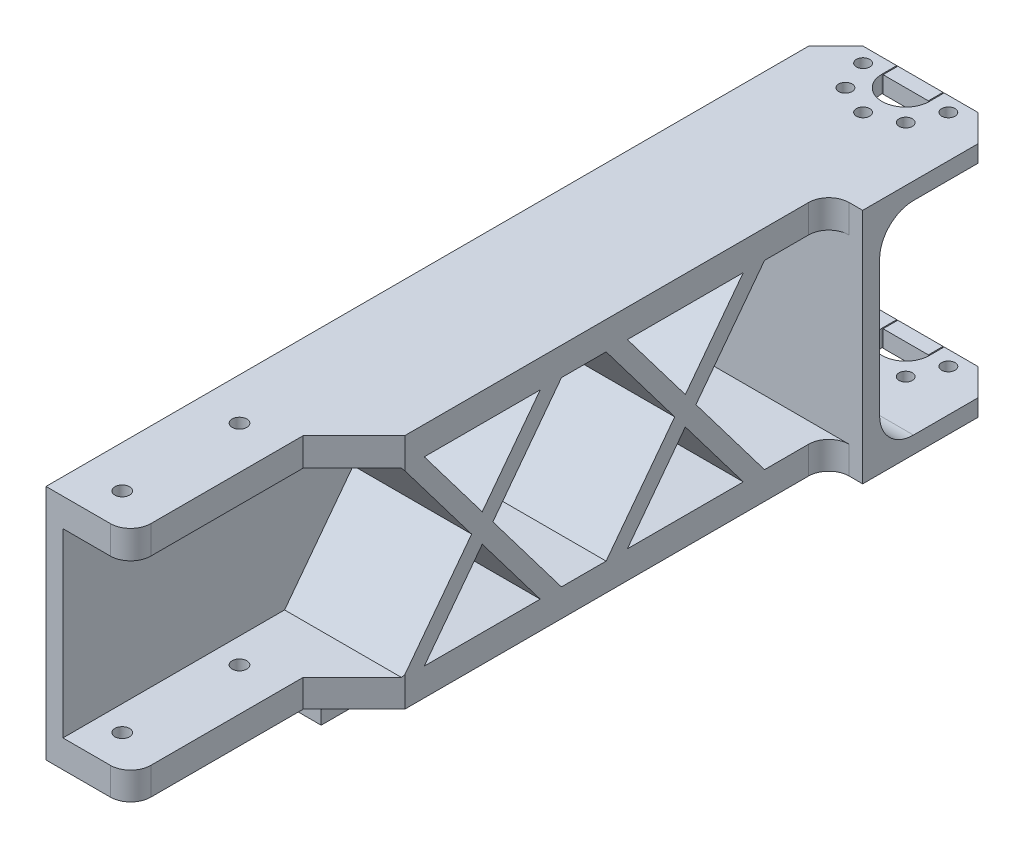
from build123d import *

# Parameters (mm, degrees)
BOSS_EXTRUDE1_DEPTH     = 15.875
CUT_EXTRUDE1_DEPTH      = 122.108682072
CUT_EXTRUDE1_DEPTH_BACK = 122.108682072
SKETCH2_R               = 1.25
SKETCH2_R_2             = 1.239025097
CUT_EXTRUDE2_DEPTH      = 122.108682072
CUT_EXTRUDE2_DEPTH_BACK = 122.108682072
SKETCH4_R               = 4.445
SKETCH5_W               = 121.475
SKETCH5_H               = 44.451600064
BOSS_EXTRUDE2_DEPTH     = 3.175
SKETCH6_W               = 22.225
SKETCH6_H               = 5.276600064
SKETCH6_H_2             = 5.175
BOSS_EXTRUDE3_DEPTH     = 121.475
SKETCH7_R               = 1.375
CUT_EXTRUDE3_DEPTH      = 236.128722189
SKETCH8_W               = 9.525
SKETCH8_H               = 31.75
CUT_EXTRUDE4_DEPTH      = 236.128722189
FILLET3_R               = 3.81
BOSS_EXTRUDE4_DEPTH     = 22.225
LPATTERN1_COUNT         = 2
LPATTERN1_PITCH         = 38.1
FILLET5_R               = 6.35
BOSS_EXTRUDE5_DEPTH     = 82.55
FILLET6_R               = 1.27
BOSS_EXTRUDE6_DEPTH     = 82.55
CUT_EXTRUDE5_DEPTH      = 236.128722189
SKETCH15_W              = 8.49
SKETCH15_H              = 2.765
BOSS_EXTRUDE7_DEPTH     = 3.175
SKETCH17_W              = 8.49
SKETCH17_H              = 2.765
BOSS_EXTRUDE8_DEPTH     = 3.175
CHAMFER1_SIZE           = 10.16
FILLET7_R               = 3.81
CHAMFER2_SIZE           = 5.08
BOSS_EXTRUDE9_DEPTH     = 0.762


with BuildPart() as part:
    # Sketch1 → Boss-Extrude1 (new, symmetric)
    with BuildSketch(Plane.ZY.offset(21)):
        Polygon((70.722864926, 19.101600064), (103.275, 19.101600064), (103.275, -19), (69.575, -19), (69.575, -22.175), (106.45, -22.175), (106.45, 22.276600064), (70.722864926, 22.276600064), align=None)
    extrude(amount=BOSS_EXTRUDE1_DEPTH, both=True)

    # Sketch2 → Cut-Extrude1 (cut, two sides: drawn at the far end of the back side and taken through both)
    with BuildSketch(Plane(origin=(0, -22.175, 0), x_dir=(1, 0, 0), z_dir=(0, 1, 0)).offset(-CUT_EXTRUDE1_DEPTH_BACK)):
        with Locations(Location((-15.343145751, -88.156854249, 0), (0, 0, 270))):
            Circle(SKETCH2_R)
        with Locations(Location((-21, -90.5, 0), (0, 0, 270))):
            Circle(SKETCH2_R)
        with Locations(Location((-26.656854249, -88.156854249, 0), (0, 0, 270))):
            Circle(SKETCH2_R)
        with Locations(Location((-29, -82.5, 0), (0, 0, 270))):
            Circle(SKETCH2_R)
        with Locations(Location((-26.656854249, -76.843145751, 0), (0, 0, 270))):
            Circle(SKETCH2_R)
        with Locations(Location((-21, -74.5, 0), (0, 0, 270))):
            Circle(SKETCH2_R_2)
        with Locations(Location((-15.343145751, -76.843145751, 0), (0, 0, 270))):
            Circle(SKETCH2_R)
        with Locations(Location((-13, -82.5, 0), (0, 0, 270))):
            Circle(SKETCH2_R)
    extrude(amount=CUT_EXTRUDE1_DEPTH + CUT_EXTRUDE1_DEPTH_BACK, mode=Mode.SUBTRACT)

    # Sketch4 → Cut-Extrude2 (cut, two sides: drawn at the far end of the back side and taken through both)
    with BuildSketch(Plane(origin=(0, 22.276600064, 0), x_dir=(1, 0, 0), z_dir=(0, 1, 0)).offset(-CUT_EXTRUDE2_DEPTH_BACK)):
        with Locations(Location((-21, -82.5, 0), (0, 0, 270))):
            Circle(SKETCH4_R)
    extrude(amount=CUT_EXTRUDE2_DEPTH + CUT_EXTRUDE2_DEPTH_BACK, mode=Mode.SUBTRACT)

    # Sketch5 → Boss-Extrude2 (add)
    with BuildSketch(Plane.ZY.offset(36.875)):
        with Locations((167.1875, 0.050800032)):
            Rectangle(SKETCH5_W, SKETCH5_H)
    extrude(amount=-BOSS_EXTRUDE2_DEPTH)

    # Sketch6 → Boss-Extrude3 (add)
    with BuildSketch(Plane.XY.offset(227.925)):
        with Locations((-22.5875, 19.638300032)):
            Rectangle(SKETCH6_W, SKETCH6_H)
        with Locations((-22.5875, -19.5875)):
            Rectangle(SKETCH6_W, SKETCH6_H_2)
    extrude(amount=-BOSS_EXTRUDE3_DEPTH)

    # Sketch7 → Cut-Extrude3 (cut, through all)
    with BuildSketch(Plane(origin=(0, 22.276600064, 0), x_dir=(1, 0, 0), z_dir=(0, 1, 0))):
        with Locations(Location((-29, -221.5, 0), (0, 0, 270))):
            Circle(SKETCH7_R)
        with Locations(Location((-29, -199.5, 0), (0, 0, 270))):
            Circle(SKETCH7_R)
    extrude(amount=-CUT_EXTRUDE3_DEPTH, mode=Mode.SUBTRACT)

    # Sketch8 → Cut-Extrude4 (cut, through all)
    with BuildSketch(Plane.XZ.offset(22.175)):
        with Locations((-16.2375, 212.05)):
            Rectangle(SKETCH8_W, SKETCH8_H)
    extrude(amount=-CUT_EXTRUDE4_DEPTH, mode=Mode.SUBTRACT)

    # Fillet3
    fillet3_edges = [part.edges().sort_by_distance(p)[0] for p in [
        (-21, 19.638300032, 227.925),
        (-21, -19.5875, 227.925),
    ]]
    fillet(fillet3_edges, radius=FILLET3_R)

    # Sketch9 → Boss-Extrude4 (add)
    with BuildSketch(Plane(origin=(-11.475, 0, 0), x_dir=(0, 0, -1), z_dir=(1, 0, 0))):
        Polygon((-148.234856752, -17), (-135.367396314, 0), (-148.234856752, 17), (-144.252905599, 17), (-133.376420737, 2.630401311), (-122.499935875, 17), (-118.517984721, 17), (-131.38544516, 0), (-118.517984721, -17), (-122.499935875, -17), (-133.376420737, -2.630401311), (-144.252905599, -17), align=None)
    boss_extrude4 = extrude(amount=-BOSS_EXTRUDE4_DEPTH)

    # LPattern1: Boss-Extrude4 ×2
    with Locations(*[(0, 0, i * LPATTERN1_PITCH) for i in range(1, LPATTERN1_COUNT)]):
        add(boss_extrude4)

    # Fillet5
    fillet5_edges = [part.edges().sort_by_distance(p)[0] for p in [
        (-21, -19, 103.275),
        (-21, 19.101600064, 103.275),
    ]]
    fillet(fillet5_edges, radius=FILLET5_R)

    # Sketch11 → Boss-Extrude5 (add)
    with BuildSketch(Plane.XY.offset(106.45)):
        Polygon((-34.335, -27.098049631), (-34.335, -22.175), (-36.875, -22.175), (-36.875, -29.638049631), (-24.175, -29.638049631), (-24.175, -27.098049631), align=None)
    extrude(amount=BOSS_EXTRUDE5_DEPTH)

    # Fillet6
    fillet6_edges = [part.edges().sort_by_distance(p)[0] for p in [
        (-34.335, -27.098049631, 147.725),
        (-34.335, -22.175, 147.725),
    ]]
    fillet(fillet6_edges, radius=FILLET6_R)

    # Sketch12 → Boss-Extrude6 (add)
    with BuildSketch(Plane.XY.offset(189)):
        Polygon((-24.175, -27.098049631), (-26.569978366, -24.703071266), (-28.964956731, -27.098049631), align=None)
    extrude(amount=-BOSS_EXTRUDE6_DEPTH)

    # Sketch14 → Cut-Extrude5 (cut, through all)
    with BuildSketch(Plane.XZ.offset(22.175)):
        with BuildLine():
            Line((-5.125, 69.575), (-36.875, 69.575))
            Line((-36.875, 69.575), (-36.875, 79.735))
            Line((-36.875, 79.735), (-25.445, 79.735))
            Line((-25.445, 79.735), (-25.445, 82.5))
            ThreePointArc((-25.445, 82.5), (-25.196913013, 81.035777968), (-24.480344811, 79.735))
            Line((-24.480344811, 79.735), (-17.519655189, 79.735))
            ThreePointArc((-17.519655189, 79.735), (-16.803086987, 81.035777968), (-16.555, 82.5))
            Line((-16.555, 82.5), (-16.555, 79.735))
            Line((-16.555, 79.735), (-5.125, 79.735))
            Line((-5.125, 79.735), (-5.125, 69.575))
        make_face()
    extrude(amount=-CUT_EXTRUDE5_DEPTH, mode=Mode.SUBTRACT)

    # Chamfer1
    # the kernel refuses this chamfer: 10.16 mm, written as the material it takes off along each edge
    with BuildSketch(Plane(origin=(-11.475, -9.128299158, 196.175), x_dir=(-0.9996219169112966, 0, 0.02749587661058728), z_dir=(0, 1, 0))) as chamfer1_piece_1_section:
        Polygon((CHAMFER1_SIZE * 0.999621916911, -CHAMFER1_SIZE * 0.0274958766106), (-CHAMFER1_SIZE * 0.0274958766106, -CHAMFER1_SIZE * 0.999621916911), (0, 0), align=None)
    chamfer1_piece_1 = extrude(amount=57.533198379, mode=Mode.PRIVATE)
    chamfer1_piece_1 = split(chamfer1_piece_1, bisect_by=Plane(origin=(-21, 19.638300032, 192.788920265), z_dir=(1, 0, 0)), keep=Keep.TOP, mode=Mode.PRIVATE)
    add(chamfer1_piece_1, mode=Mode.SUBTRACT)
    with BuildSketch(Plane(origin=(-11.475, -48.303299158, 196.175), x_dir=(-0.9996219169112966, 0, 0.02749587661058728), z_dir=(0, 1, 0))) as chamfer1_piece_2_section:
        Polygon((CHAMFER1_SIZE * 0.999621916911, -CHAMFER1_SIZE * 0.0274958766106), (-CHAMFER1_SIZE * 0.0274958766106, -CHAMFER1_SIZE * 0.999621916911), (0, 0), align=None)
    chamfer1_piece_2 = extrude(amount=57.431598315, mode=Mode.PRIVATE)
    chamfer1_piece_2 = split(chamfer1_piece_2, bisect_by=Plane(origin=(-21, -19.5875, 192.788920265), z_dir=(1, 0, 0)), keep=Keep.TOP, mode=Mode.PRIVATE)
    add(chamfer1_piece_2, mode=Mode.SUBTRACT)

    # Fillet7
    fillet7_edges = [part.edges().sort_by_distance(p)[0] for p in [
        (-11.475, 19.638300032, 106.45),
        (-11.475, -19.5875, 106.45),
    ]]
    fillet(fillet7_edges, radius=FILLET7_R)

    # Chamfer2
    chamfer2_edges = [part.edges().sort_by_distance(p)[0] for p in [
        (-5.125, -20.5875, 79.735),
        (-36.875, -20.5875, 79.735),
        (-5.125, 20.689100064, 79.735),
        (-36.875, 20.689100064, 79.735),
    ]]
    chamfer(chamfer2_edges, length=CHAMFER2_SIZE)

    # Sketch18 → Boss-Extrude9 (add)
    # profile 1 of 6: a face of its own
    with BuildSketch(Plane(origin=(-33.7, 0, 0), x_dir=(0, 0, -1), z_dir=(1, 0, 0))):
        with BuildLine():
            Line((-153.784229193, 6.875972625), (-153.784229193, 5.570495519))
            add(Edge.make_bspline(
                [(-153.784229193, 5.570495519), (-153.78447547, 5.483681049), (-153.784960426, 5.312731111), (-153.781434088, 5.060104334), (-153.775429266, 4.815104108), (-153.768703986, 4.577142121), (-153.757537017, 4.346091548), (-153.74529407, 4.122111186), (-153.731996283, 3.905132454), (-153.719776818, 3.763234825), (-153.713757159, 3.693331981)],
                knots=[0, 0, 0, 0, 1.108788663, 2.183361313, 3.226731966, 4.238906683, 5.223730476, 6.181032146, 7.103924245, 8, 8, 8, 8], degree=3))
            Line((-153.713757159, 3.693331981), (-153.724504892, 3.694050577))
            add(Edge.make_bspline(
                [(-153.724504892, 3.694050577), (-153.771784627, 3.811311397), (-153.868859565, 4.05207177), (-154.030553624, 4.41072253), (-154.201420622, 4.767436486), (-154.324537463, 4.999071707), (-154.384865125, 5.112573737)],
                knots=[0, 0, 0, 0, 0.969000566, 1.989555744, 3.014875613, 4, 4, 4, 4], degree=3))
            Line((-154.384865125, 5.112573737), (-155.318936063, 6.875167605))
            Line((-155.318936063, 6.875167605), (-156.196611608, 6.875167605))
            Line((-156.196611608, 6.875167605), (-156.196611608, 2.51959323))
            Line((-156.196611608, 2.51959323), (-155.46896261, 2.51959323))
            Line((-155.46896261, 2.51959323), (-155.46896261, 3.856284456))
            add(Edge.make_bspline(
                [(-155.46896261, 3.856284456), (-155.46908302, 3.950283681), (-155.469318899, 4.134423845), (-155.472236083, 4.403774194), (-155.474742855, 4.660281321), (-155.481228605, 4.903901107), (-155.486998086, 5.13666602), (-155.496698186, 5.359510985), (-155.505980252, 5.573425166), (-155.514136603, 5.712946629), (-155.518128029, 5.781223433)],
                knots=[0, 0, 0, 0, 1.171406079, 2.294730703, 3.356826466, 4.368057606, 5.33173858, 6.258348936, 7.147698386, 8, 8, 8, 8], degree=3))
            Line((-155.518128029, 5.781223433), (-155.49611402, 5.782026052))
            add(Edge.make_bspline(
                [(-155.49611402, 5.782026052), (-155.446972057, 5.659565606), (-155.346739531, 5.40978886), (-155.178935485, 5.039911421), (-155.001921255, 4.674979243), (-154.878142422, 4.436827616), (-154.817520811, 4.320191071)],
                knots=[0, 0, 0, 0, 0.98187706, 2.002687931, 3.021801436, 4, 4, 4, 4], degree=3))
            Line((-154.817520811, 4.320191071), (-153.865003238, 2.51959323))
            Line((-153.865003238, 2.51959323), (-153.056580194, 2.51959323))
            Line((-153.056580194, 2.51959323), (-153.056580194, 6.875167605))
            Line((-153.056580194, 6.875167605), (-153.784229193, 6.875972625))
        make_face()
    # profile 2 of 6: a face of its own
    with BuildSketch(Plane(origin=(-33.7, 0, 0), x_dir=(0, 0, -1), z_dir=(1, 0, 0))):
        with BuildLine():
            Line((-152.158491877, 2.545664346), (-151.325956652, 2.545664346))
            Line((-151.325956652, 2.545664346), (-151.325956652, 4.312815458))
            Line((-151.325956652, 4.312815458), (-151.043397933, 4.312815458))
            add(Edge.make_bspline(
                [(-151.043397933, 4.312815458), (-151.020116935, 4.312629528), (-150.974322245, 4.312263796), (-150.907690471, 4.305622213), (-150.844710057, 4.294546892), (-150.786397272, 4.276982957), (-150.731822853, 4.255385538), (-150.682321062, 4.226634819), (-150.635981149, 4.194321952), (-150.594394025, 4.154838787), (-150.556530015, 4.108797286), (-150.519980337, 4.056375759), (-150.487794472, 3.994799049), (-150.456381733, 3.926409266), (-150.429254847, 3.849561841), (-150.402405374, 3.765959509), (-150.380064022, 3.673755628), (-150.366763652, 3.609516607), (-150.359856172, 3.5761544)],
                knots=[0, 0, 0, 0, 0.996161344, 1.959490833, 2.863065066, 3.728777099, 4.56255315, 5.36890551, 6.173560641, 6.975918819, 7.814273396, 8.722375339, 9.705928526, 10.783915222, 11.941699738, 13.191639415, 14.541492272, 16, 16, 16, 16], degree=3))
            add(Edge.make_bspline(
                [(-150.359856172, 3.5761544), (-150.347172865, 3.51248186), (-150.322861848, 3.390436072), (-150.285466531, 3.215466651), (-150.247477803, 3.05722524), (-150.212465806, 2.915625934), (-150.1766324, 2.793695477), (-150.146487515, 2.691321829), (-150.118423004, 2.610432738), (-150.098154609, 2.564887706), (-150.089446369, 2.545319452)],
                knots=[0, 0, 0, 0, 1.459770129, 2.798047569, 4.022515533, 5.118804131, 6.077119604, 6.879484601, 7.518574734, 8, 8, 8, 8], degree=3))
            Line((-150.089446369, 2.545319452), (-149.232635718, 2.545664346))
            add(Edge.make_bspline(
                [(-149.232635718, 2.545664346), (-149.244144057, 2.571885506), (-149.27048373, 2.631899101), (-149.303988323, 2.73729745), (-149.341893864, 2.867004922), (-149.38067392, 3.019220809), (-149.421254764, 3.187766703), (-149.465172423, 3.366494012), (-149.50909941, 3.553465445), (-149.539062356, 3.68076861), (-149.554362728, 3.745775094)],
                knots=[0, 0, 0, 0, 0.552213745, 1.263877434, 2.131178881, 3.160222016, 4.294062084, 5.476483125, 6.711383475, 8, 8, 8, 8], degree=3))
            add(Edge.make_bspline(
                [(-149.554362728, 3.745775094), (-149.567192481, 3.798993869), (-149.591990861, 3.901859401), (-149.641231319, 4.046808684), (-149.697748442, 4.177557345), (-149.762011225, 4.293912743), (-149.836373712, 4.395786592), (-149.921846252, 4.482135395), (-150.020154042, 4.551498084), (-150.092406961, 4.584593382), (-150.128778704, 4.601253382)],
                knots=[0, 0, 0, 0, 1.223024066, 2.363959412, 3.416475858, 4.403144149, 5.328653403, 6.226529264, 7.107244077, 8, 8, 8, 8], degree=3))
            Line((-150.128778704, 4.601253382), (-150.128132928, 4.618538899))
            add(Edge.make_bspline(
                [(-150.128132928, 4.618538899), (-150.077554527, 4.640470017), (-149.976629392, 4.684231799), (-149.839359849, 4.777599322), (-149.713340614, 4.88833623), (-149.620191881, 4.995979364), (-149.554926608, 5.091584295), (-149.511518513, 5.167711217), (-149.474276544, 5.247664472), (-149.444191144, 5.33173326), (-149.4193357, 5.419537131), (-149.40152435, 5.51163573), (-149.389814986, 5.607490951), (-149.387536116, 5.672752954), (-149.38638088, 5.705836458)],
                knots=[0, 0, 0, 0, 1.415552172, 2.824620626, 4.248504358, 5.723320941, 6.471745732, 7.223921719, 7.975309537, 8.737754725, 9.518628704, 10.320683298, 11.148697904, 12, 12, 12, 12], degree=3))
            add(Edge.make_bspline(
                [(-149.38638088, 5.705836458), (-149.388703662, 5.739746794), (-149.393268346, 5.806386692), (-149.406894844, 5.903345987), (-149.423043465, 5.995848679), (-149.443263583, 6.083207064), (-149.468079968, 6.165796508), (-149.496585732, 6.243612788), (-149.529128545, 6.316621571), (-149.566421005, 6.384413386), (-149.60740769, 6.447245042), (-149.651265194, 6.506283303), (-149.701316235, 6.558326519), (-149.753568187, 6.60756697), (-149.811163544, 6.650481415), (-149.872211708, 6.689686295), (-149.937721797, 6.722964168), (-150.029219919, 6.76046179), (-150.14530935, 6.798858265), (-150.2819957, 6.841750058), (-150.416641379, 6.873910739), (-150.54711036, 6.90090002), (-150.674733173, 6.918335329), (-150.798786655, 6.930892024), (-150.919850532, 6.932948616), (-150.999292438, 6.929360641), (-151.038338952, 6.927597115)],
                knots=[0, 0, 0, 0, 1.04254728, 2.048792541, 3.00224853, 3.923105087, 4.79804786, 5.646501919, 6.464227683, 7.248100506, 8.017504481, 8.765055913, 9.500244792, 10.229727568, 10.965537121, 11.700200404, 12.45355415, 13.216173449, 14.732128481, 16.203485081, 17.610025167, 18.977448705, 20.289434687, 21.560307215, 22.800865913, 24, 24, 24, 24], degree=3))
            add(Edge.make_bspline(
                [(-151.038338952, 6.927597115), (-151.142710082, 6.926370079), (-151.346710825, 6.923971752), (-151.59718684, 6.907515826), (-151.787142677, 6.889753053), (-151.918831852, 6.875106189), (-152.042083899, 6.858925349), (-152.12109864, 6.846114274), (-152.159310501, 6.839918785)],
                knots=[0, 0, 0, 0, 1.668967631, 3.262115064, 4.012317135, 4.719957541, 5.380966089, 6, 6, 6, 6], degree=3))
            Line((-152.159310501, 6.839918785), (-152.158491877, 2.545664346))
        make_face()
        with BuildLine():
            add(Edge.make_bspline(
                [(-151.325956652, 6.271426825), (-151.305282152, 6.276726825), (-151.256844897, 6.289143931), (-151.171532053, 6.297826115), (-151.06441091, 6.304689515), (-150.985643666, 6.30478358), (-150.942466385, 6.304835143)],
                knots=[0, 0, 0, 0, 0.662678564, 1.552556538, 2.658402302, 4, 4, 4, 4], degree=3))
            add(Edge.make_bspline(
                [(-150.942466385, 6.304835143), (-150.901672634, 6.305081522), (-150.819974195, 6.305574949), (-150.698384418, 6.281999303), (-150.579140402, 6.241066117), (-150.482577542, 6.193459011), (-150.410224487, 6.143198487), (-150.361957794, 6.09563123), (-150.321085104, 6.039194061), (-150.285869156, 5.974431955), (-150.26006297, 5.900246358), (-150.238072871, 5.818526129), (-150.224600422, 5.727805056), (-150.220864032, 5.66435927), (-150.218915305, 5.631268906)],
                knots=[0, 0, 0, 0, 1.299862039, 2.603258977, 3.929761489, 5.318199205, 6.024796415, 6.733972064, 7.470037642, 8.242600901, 9.078567026, 9.971200204, 10.941872601, 12, 12, 12, 12], degree=3))
            add(Edge.make_bspline(
                [(-150.218915305, 5.631268906), (-150.219841826, 5.605560755), (-150.221652272, 5.555326325), (-150.231696559, 5.482124472), (-150.247127418, 5.412621189), (-150.268977447, 5.347052139), (-150.298242319, 5.285674704), (-150.333196189, 5.228360606), (-150.374976927, 5.175544089), (-150.421400297, 5.12616591), (-150.473986657, 5.082037231), (-150.531443748, 5.04312415), (-150.594758499, 5.011193378), (-150.662479769, 4.984282135), (-150.735409292, 4.962740184), (-150.813060503, 4.94758222), (-150.895775319, 4.9374308), (-150.952541631, 4.935667568), (-150.98179872, 4.934758806)],
                knots=[0, 0, 0, 0, 1.059346065, 2.069991167, 3.039184971, 3.989375718, 4.910601955, 5.835121727, 6.749101981, 7.680445877, 8.622807178, 9.571664136, 10.532985652, 11.538164881, 12.57081342, 13.661090204, 14.794536924, 16, 16, 16, 16], degree=3))
            Line((-150.98179872, 4.934758806), (-151.325956652, 4.935577429))
            Line((-151.325956652, 4.935577429), (-151.325956652, 6.271426825))
        make_face(mode=Mode.SUBTRACT)
    # profile 3 of 6: a face of its own
    with BuildSketch(Plane(origin=(-33.7, 0, 0), x_dir=(0, 0, -1), z_dir=(1, 0, 0))):
        with BuildLine():
            Line((-155.280335928, -4.927307934), (-155.280335928, -4.915914424))
            Line((-155.280335928, -4.915914424), (-154.923507338, -4.562715625))
            add(Edge.make_bspline(
                [(-154.923507338, -4.562715625), (-154.846387042, -4.484813077), (-154.694632231, -4.331518976), (-154.484916138, -4.092136642), (-154.295566432, -3.849527246), (-154.150659641, -3.645397797), (-154.048819061, -3.478739381), (-153.982883809, -3.351689584), (-153.926379814, -3.222517898), (-153.879354937, -3.090872744), (-153.842376036, -2.956942864), (-153.815346476, -2.820556036), (-153.797867991, -2.681685772), (-153.793699009, -2.588173899), (-153.791602405, -2.541146274)],
                knots=[0, 0, 0, 0, 1.659202022, 3.264923779, 4.814209511, 6.316896139, 7.051567576, 7.769144172, 8.482047353, 9.1843673, 9.883576409, 10.583408793, 11.287588645, 12, 12, 12, 12], degree=3))
            add(Edge.make_bspline(
                [(-153.791602405, -2.541146274), (-153.792168252, -2.497125642), (-153.793282256, -2.410460646), (-153.808656173, -2.283297046), (-153.832960787, -2.161183601), (-153.867954163, -2.044645443), (-153.914554102, -1.93409838), (-153.97020222, -1.828861322), (-154.036394593, -1.729010122), (-154.112247898, -1.634822556), (-154.198851853, -1.547981962), (-154.298374012, -1.47343055), (-154.408067128, -1.408781335), (-154.529686139, -1.356589889), (-154.662071459, -1.31496444), (-154.805537914, -1.284160169), (-154.960066308, -1.263237003), (-155.06710206, -1.259195408), (-155.122346407, -1.25710942)],
                knots=[0, 0, 0, 0, 1.009543328, 1.987524111, 2.933968874, 3.863854154, 4.774078899, 5.682489326, 6.591612952, 7.518557726, 8.453666412, 9.397555261, 10.363899254, 11.368743061, 12.427215963, 13.543452787, 14.732102632, 16, 16, 16, 16], degree=3))
            add(Edge.make_bspline(
                [(-155.122346407, -1.25710942), (-155.18332199, -1.259156111), (-155.303204528, -1.263180059), (-155.478967158, -1.285505495), (-155.647019616, -1.321500931), (-155.805765068, -1.370931789), (-155.954429066, -1.428591387), (-156.090186151, -1.493526497), (-156.213927099, -1.562098926), (-156.287249375, -1.616069269), (-156.32280205, -1.642238534)],
                knots=[0, 0, 0, 0, 1.142131743, 2.245516072, 3.313064714, 4.356728811, 5.356075675, 6.296497493, 7.174001758, 8, 8, 8, 8], degree=3))
            Line((-156.32280205, -1.642238534), (-156.090280187, -2.244136411))
            add(Edge.make_bspline(
                [(-156.090280187, -2.244136411), (-156.064471491, -2.225123975), (-156.011266071, -2.185929254), (-155.925601122, -2.131482591), (-155.832370327, -2.079945383), (-155.733817552, -2.030713133), (-155.629485773, -1.988709844), (-155.520591575, -1.957356083), (-155.407681507, -1.937123867), (-155.33083577, -1.9333858), (-155.291967102, -1.931495081)],
                knots=[0, 0, 0, 0, 0.882381775, 1.819057125, 2.791981266, 3.814391476, 4.850565017, 5.88354078, 6.929492323, 8, 8, 8, 8], degree=3))
            add(Edge.make_bspline(
                [(-155.291967102, -1.931495081), (-155.263798128, -1.932680515), (-155.209179783, -1.934979015), (-155.130238271, -1.945771316), (-155.057196883, -1.961841548), (-154.989770986, -1.98406245), (-154.928404776, -2.012601171), (-154.872880006, -2.047068248), (-154.823986916, -2.088028403), (-154.766206637, -2.148918906), (-154.708632812, -2.237393282), (-154.657471141, -2.354337391), (-154.628548432, -2.484035429), (-154.625641074, -2.574054965), (-154.62413683, -2.620630368)],
                knots=[0, 0, 0, 0, 0.93230204, 1.807690748, 2.631964675, 3.403485345, 4.151360469, 4.865902888, 5.558923755, 6.255646087, 7.636553115, 9.02477282, 10.460640741, 12, 12, 12, 12], degree=3))
            add(Edge.make_bspline(
                [(-154.62413683, -2.620630368), (-154.625638781, -2.656473677), (-154.628668576, -2.728778194), (-154.645913211, -2.837297709), (-154.671841732, -2.947200893), (-154.710405875, -3.057791107), (-154.757895641, -3.170085527), (-154.815490097, -3.283540574), (-154.884013893, -3.39773624), (-154.963375025, -3.513383633), (-155.052218259, -3.631915012), (-155.149468362, -3.754975909), (-155.254112856, -3.88381544), (-155.368257383, -4.017224446), (-155.490888432, -4.15573868), (-155.623486892, -4.298025866), (-155.763196658, -4.446473529), (-155.860226208, -4.546144169), (-155.909812532, -4.597080204)],
                knots=[0, 0, 0, 0, 0.714042855, 1.440395043, 2.184640807, 2.96058558, 3.769988571, 4.611854656, 5.492656414, 6.420700846, 7.404361908, 8.442699269, 9.544774642, 10.710251598, 11.939640591, 13.229377797, 14.584091463, 16, 16, 16, 16], degree=3))
            Line((-155.909812532, -4.597080204), (-156.384805372, -5.102968677))
            Line((-156.384805372, -5.102968677), (-156.384805372, -5.602513019))
            Line((-156.384805372, -5.602513019), (-153.711488539, -5.602513019))
            Line((-153.711488539, -5.602513019), (-153.711488539, -4.927307934))
            Line((-153.711488539, -4.927307934), (-155.280335928, -4.927307934))
        make_face()
    # profile 4 of 6: a face of its own
    with BuildSketch(Plane(origin=(-33.7, 0, 0), x_dir=(0, 0, -1), z_dir=(1, 0, 0))):
        with BuildLine():
            add(Edge.make_bspline(
                [(-151.747877407, -5.65003959), (-151.693157485, -5.647769937), (-151.585981546, -5.643324532), (-151.430114225, -5.615054408), (-151.283709293, -5.569208142), (-151.1470325, -5.504528212), (-151.020173233, -5.421913311), (-150.90273255, -5.321783478), (-150.795949505, -5.203505958), (-150.699391291, -5.068171163), (-150.61219055, -4.91728738), (-150.538375401, -4.749780015), (-150.474127746, -4.567999149), (-150.422243879, -4.370867191), (-150.381398801, -4.158692322), (-150.35248186, -3.931529765), (-150.334175085, -3.689183558), (-150.331654824, -3.522576774), (-150.330356921, -3.43677632)],
                knots=[0, 0, 0, 0, 0.891408064, 1.745936256, 2.572046001, 3.384183195, 4.201267044, 5.031441608, 5.891421096, 6.790473701, 7.735400906, 8.72533739, 9.768215703, 10.873507909, 12.042938546, 13.285922414, 14.602283284, 16, 16, 16, 16], degree=3))
            add(Edge.make_bspline(
                [(-150.330356921, -3.43677632), (-150.330632016, -3.36245622), (-150.331171611, -3.216678225), (-150.345851673, -3.002577075), (-150.368655997, -2.797225399), (-150.404337327, -2.601162465), (-150.449134276, -2.414209208), (-150.503777528, -2.235914802), (-150.570703993, -2.067340025), (-150.645425176, -1.907413059), (-150.733149993, -1.761453014), (-150.834386084, -1.632389852), (-150.95043221, -1.523617044), (-151.078626833, -1.431872111), (-151.220912288, -1.360473506), (-151.37595508, -1.308170885), (-151.543531169, -1.272898831), (-151.660104022, -1.265720409), (-151.720099426, -1.262025962)],
                knots=[0, 0, 0, 0, 1.232204757, 2.416955028, 3.556967175, 4.656941594, 5.719331404, 6.743729146, 7.746384706, 8.724983175, 9.668069731, 10.564373225, 11.435956103, 12.296892263, 13.169992217, 14.065276449, 15.004274861, 16, 16, 16, 16], degree=3))
            add(Edge.make_bspline(
                [(-151.720099426, -1.262025962), (-151.778159393, -1.264952258), (-151.891598306, -1.270669723), (-152.055388168, -1.30330911), (-152.207981476, -1.353452288), (-152.34966078, -1.421912395), (-152.479964842, -1.509539078), (-152.598826332, -1.615541492), (-152.706270628, -1.739723163), (-152.800526154, -1.882389981), (-152.884269437, -2.039352558), (-152.957244705, -2.208804572), (-153.018792477, -2.389923703), (-153.068400481, -2.583159474), (-153.107380845, -2.788186575), (-153.136302828, -3.005064066), (-153.152317478, -3.233861139), (-153.154574703, -3.390318402), (-153.155729655, -3.47037269)],
                knots=[0, 0, 0, 0, 0.944846204, 1.846062465, 2.707557854, 3.552303352, 4.397866779, 5.254107521, 6.1362526, 7.061934359, 8.030246202, 9.027537041, 10.060510809, 11.139504921, 12.270844059, 13.454374221, 14.697482908, 16, 16, 16, 16], degree=3))
            add(Edge.make_bspline(
                [(-153.155729655, -3.47037269), (-153.15515763, -3.544966071), (-153.154035427, -3.691303957), (-153.138911922, -3.906023929), (-153.114021091, -4.111869699), (-153.076966732, -4.308242236), (-153.030287518, -4.496048028), (-152.97357082, -4.674963517), (-152.903949364, -4.844025128), (-152.826527301, -5.003645205), (-152.737578412, -5.150301589), (-152.633256596, -5.278311164), (-152.517122457, -5.388929866), (-152.387274195, -5.479409882), (-152.245414143, -5.551906348), (-152.090672175, -5.603701967), (-151.923732707, -5.639207485), (-151.807688654, -5.646358767), (-151.747877407, -5.65003959)],
                knots=[0, 0, 0, 0, 1.232454495, 2.417838968, 3.554913347, 4.657085958, 5.717888946, 6.751365185, 7.755525192, 8.736583815, 9.681064619, 10.58269245, 11.457587613, 12.322870633, 13.188871501, 14.081003943, 15.012277006, 16, 16, 16, 16], degree=3))
        make_face()
        with BuildLine():
            add(Edge.make_bspline(
                [(-151.74224467, -4.984667589), (-151.765579713, -4.983060821), (-151.811384152, -4.979906891), (-151.877509593, -4.960533641), (-151.9382298, -4.92844324), (-151.994857281, -4.885065058), (-152.046376937, -4.829193578), (-152.094085098, -4.762359127), (-152.13654101, -4.683395345), (-152.174893056, -4.593157265), (-152.208006341, -4.490983714), (-152.237484367, -4.377421136), (-152.262447058, -4.252069514), (-152.283836732, -4.115142678), (-152.299792236, -3.966353062), (-152.311850413, -3.805937109), (-152.320352442, -3.633525321), (-152.321686237, -3.514632268), (-152.322375806, -3.453164793)],
                knots=[0, 0, 0, 0, 0.63079115, 1.238182219, 1.84570785, 2.477634685, 3.156537967, 3.891964552, 4.69143895, 5.57447556, 6.538582907, 7.591391793, 8.743788032, 9.991433466, 11.335707708, 12.786810728, 14.338787447, 16, 16, 16, 16], degree=3))
            add(Edge.make_bspline(
                [(-152.322375806, -3.453164793), (-152.321550632, -3.391977503), (-152.319951271, -3.273383624), (-152.313259951, -3.101413343), (-152.299523048, -2.941080131), (-152.283373976, -2.792169025), (-152.260078738, -2.655289051), (-152.233323681, -2.529907128), (-152.201920773, -2.416099935), (-152.164868121, -2.314066034), (-152.124483324, -2.223496516), (-152.079090204, -2.145222099), (-152.03119436, -2.077816744), (-151.978477545, -2.023434091), (-151.922583026, -1.979967869), (-151.862263167, -1.949507234), (-151.798000095, -1.93041179), (-151.753825648, -1.928407625), (-151.731571357, -1.927397963)],
                knots=[0, 0, 0, 0, 1.656136498, 3.209941977, 4.656282368, 6.010605211, 7.262348999, 8.412152801, 9.479359576, 10.454497352, 11.347710908, 12.159180782, 12.899960335, 13.579568553, 14.202015004, 14.807009536, 15.398992893, 16, 16, 16, 16], degree=3))
            add(Edge.make_bspline(
                [(-151.731571357, -1.927397963), (-151.707664214, -1.928927573), (-151.660665429, -1.931934616), (-151.593048352, -1.952480506), (-151.530530896, -1.984966996), (-151.473312499, -2.030231133), (-151.421403607, -2.087754879), (-151.374706833, -2.157468655), (-151.333075507, -2.239288409), (-151.296718992, -2.332782964), (-151.265111443, -2.437299004), (-151.237391558, -2.552233843), (-151.213966059, -2.677536397), (-151.194266934, -2.812817936), (-151.179579884, -2.958271313), (-151.170519312, -3.114110513), (-151.163273427, -3.280199329), (-151.16302109, -3.394430455), (-151.162891346, -3.453164793)],
                knots=[0, 0, 0, 0, 0.648240215, 1.27436818, 1.900890804, 2.550273966, 3.242762161, 3.995128316, 4.820502947, 5.72885599, 6.713496292, 7.78126474, 8.935411732, 10.17117551, 11.489774357, 12.900762335, 14.406461714, 16, 16, 16, 16], degree=3))
            add(Edge.make_bspline(
                [(-151.162891346, -3.453164793), (-151.163418576, -3.513533908), (-151.164442344, -3.630757784), (-151.170733192, -3.801027635), (-151.182229624, -3.96006524), (-151.197709822, -4.107928379), (-151.216878469, -4.244745108), (-151.241345096, -4.370611184), (-151.270652674, -4.485259512), (-151.304072394, -4.58881573), (-151.341209697, -4.681072914), (-151.383692597, -4.761280255), (-151.431217472, -4.829170943), (-151.483349538, -4.884929102), (-151.539512794, -4.929622889), (-151.601294925, -4.961231782), (-151.667842033, -4.98086878), (-151.713957587, -4.983390675), (-151.737307323, -4.984667589)],
                knots=[0, 0, 0, 0, 1.631201677, 3.167443897, 4.602949942, 5.938788423, 7.183965077, 8.334656622, 9.401515449, 10.379429148, 11.273027502, 12.085299036, 12.826571576, 13.505320596, 14.141614029, 14.755557553, 15.369900188, 16, 16, 16, 16], degree=3))
            Line((-151.737307323, -4.984667589), (-151.74224467, -4.984667589))
        make_face(mode=Mode.SUBTRACT)
    # profile 5 of 6: a face of its own
    with BuildSketch(Plane(origin=(-33.7, 0, 0), x_dir=(0, 0, -1), z_dir=(1, 0, 0))):
        with BuildLine():
            Line((-148.777389867, -4.927307934), (-148.777389867, -4.915914424))
            Line((-148.777389867, -4.915914424), (-148.420561277, -4.562715625))
            add(Edge.make_bspline(
                [(-148.420561277, -4.562715625), (-148.343440981, -4.484813077), (-148.19168617, -4.331518976), (-147.981970077, -4.092136642), (-147.792620372, -3.849527246), (-147.64771358, -3.645397797), (-147.545873, -3.478739381), (-147.479937748, -3.351689584), (-147.423433753, -3.222517898), (-147.376408876, -3.090872744), (-147.339429975, -2.956942864), (-147.312400416, -2.820556036), (-147.294921931, -2.681685772), (-147.290752948, -2.588173899), (-147.288656344, -2.541146274)],
                knots=[0, 0, 0, 0, 1.659202022, 3.264923779, 4.814209511, 6.316896139, 7.051567576, 7.769144172, 8.482047353, 9.1843673, 9.883576409, 10.583408793, 11.287588645, 12, 12, 12, 12], degree=3))
            add(Edge.make_bspline(
                [(-147.288656344, -2.541146274), (-147.289222191, -2.497125642), (-147.290336195, -2.410460646), (-147.305710113, -2.283297046), (-147.330014726, -2.161183601), (-147.365008102, -2.044645443), (-147.411608041, -1.93409838), (-147.467256159, -1.828861322), (-147.533448533, -1.729010122), (-147.609301837, -1.634822556), (-147.695905792, -1.547981962), (-147.795427951, -1.47343055), (-147.905121067, -1.408781335), (-148.026740078, -1.356589889), (-148.159125398, -1.31496444), (-148.302591853, -1.284160169), (-148.457120247, -1.263237003), (-148.564155999, -1.259195408), (-148.619400347, -1.25710942)],
                knots=[0, 0, 0, 0, 1.009543328, 1.987524111, 2.933968874, 3.863854154, 4.774078899, 5.682489326, 6.591612952, 7.518557726, 8.453666412, 9.397555261, 10.363899254, 11.368743061, 12.427215963, 13.543452787, 14.732102632, 16, 16, 16, 16], degree=3))
            add(Edge.make_bspline(
                [(-148.619400347, -1.25710942), (-148.680375929, -1.259156111), (-148.800258467, -1.263180059), (-148.976021098, -1.285505495), (-149.144073556, -1.321500931), (-149.302819007, -1.370931789), (-149.451483005, -1.428591387), (-149.587240091, -1.493526497), (-149.710981039, -1.562098926), (-149.784303314, -1.616069269), (-149.819855989, -1.642238534)],
                knots=[0, 0, 0, 0, 1.142131743, 2.245516072, 3.313064714, 4.356728811, 5.356075675, 6.296497493, 7.174001758, 8, 8, 8, 8], degree=3))
            Line((-149.819855989, -1.642238534), (-149.587334126, -2.244136411))
            add(Edge.make_bspline(
                [(-149.587334126, -2.244136411), (-149.56152543, -2.225123975), (-149.50832001, -2.185929254), (-149.422655061, -2.131482591), (-149.329424266, -2.079945383), (-149.230871491, -2.030713133), (-149.126539712, -1.988709844), (-149.017645514, -1.957356083), (-148.904735446, -1.937123867), (-148.82788971, -1.9333858), (-148.789021041, -1.931495081)],
                knots=[0, 0, 0, 0, 0.882381775, 1.819057125, 2.791981266, 3.814391476, 4.850565017, 5.88354078, 6.929492323, 8, 8, 8, 8], degree=3))
            add(Edge.make_bspline(
                [(-148.789021041, -1.931495081), (-148.760852067, -1.932680515), (-148.706233722, -1.934979015), (-148.62729221, -1.945771316), (-148.554250822, -1.961841548), (-148.486824925, -1.98406245), (-148.425458715, -2.012601171), (-148.369933945, -2.047068248), (-148.321040855, -2.088028403), (-148.263260576, -2.148918906), (-148.205686751, -2.237393282), (-148.15452508, -2.354337391), (-148.125602371, -2.484035429), (-148.122695013, -2.574054965), (-148.121190769, -2.620630368)],
                knots=[0, 0, 0, 0, 0.93230204, 1.807690748, 2.631964675, 3.403485345, 4.151360469, 4.865902888, 5.558923755, 6.255646087, 7.636553115, 9.02477282, 10.460640741, 12, 12, 12, 12], degree=3))
            add(Edge.make_bspline(
                [(-148.121190769, -2.620630368), (-148.122692721, -2.656473677), (-148.125722515, -2.728778194), (-148.142967151, -2.837297709), (-148.168895671, -2.947200893), (-148.207459814, -3.057791107), (-148.25494958, -3.170085527), (-148.312544036, -3.283540574), (-148.381067833, -3.39773624), (-148.460428964, -3.513383633), (-148.549272198, -3.631915012), (-148.646522301, -3.754975909), (-148.751166795, -3.88381544), (-148.865311322, -4.017224446), (-148.987942372, -4.15573868), (-149.120540832, -4.298025866), (-149.260250597, -4.446473529), (-149.357280148, -4.546144169), (-149.406866471, -4.597080204)],
                knots=[0, 0, 0, 0, 0.714042855, 1.440395043, 2.184640807, 2.96058558, 3.769988571, 4.611854656, 5.492656414, 6.420700846, 7.404361908, 8.442699269, 9.544774642, 10.710251598, 11.939640591, 13.229377797, 14.584091463, 16, 16, 16, 16], degree=3))
            Line((-149.406866471, -4.597080204), (-149.881859312, -5.102968677))
            Line((-149.881859312, -5.102968677), (-149.881859312, -5.602513019))
            Line((-149.881859312, -5.602513019), (-147.208542479, -5.602513019))
            Line((-147.208542479, -5.602513019), (-147.208542479, -4.927307934))
            Line((-147.208542479, -4.927307934), (-148.777389867, -4.927307934))
        make_face()
    # profile 6 of 6: a face of its own
    with BuildSketch(Plane(origin=(-33.7, 0, 0), x_dir=(0, 0, -1), z_dir=(1, 0, 0))):
        with BuildLine():
            add(Edge.make_bspline(
                [(-146.341525042, -2.157027036), (-146.319271029, -2.143519845), (-146.272465944, -2.115111252), (-146.195259652, -2.077504319), (-146.109555766, -2.039495827), (-146.016086403, -2.003006479), (-145.916207347, -1.970896985), (-145.81181523, -1.947073407), (-145.704026032, -1.93216375), (-145.631007714, -1.928998417), (-145.594088243, -1.927397963)],
                knots=[0, 0, 0, 0, 0.789517344, 1.660528633, 2.603012169, 3.634206293, 4.703625655, 5.783272812, 6.879179917, 8, 8, 8, 8], degree=3))
            add(Edge.make_bspline(
                [(-145.594088243, -1.927397963), (-145.568672251, -1.928197277), (-145.519375205, -1.929747632), (-145.447813852, -1.936825114), (-145.381683332, -1.949403783), (-145.320095964, -1.964700557), (-145.263570017, -1.9848268), (-145.212807665, -2.010510013), (-145.166610949, -2.039457495), (-145.113153275, -2.083554994), (-145.056906267, -2.147776123), (-145.008973245, -2.237208011), (-144.978732844, -2.33737549), (-144.976013399, -2.407901889), (-144.974603966, -2.444454284)],
                knots=[0, 0, 0, 0, 1.002343817, 1.944153497, 2.831185645, 3.653858711, 4.444110717, 5.190523602, 5.892507091, 6.588768807, 7.916765639, 9.227316692, 10.562974774, 12, 12, 12, 12], degree=3))
            add(Edge.make_bspline(
                [(-144.974603966, -2.444454284), (-144.976489196, -2.469113151), (-144.980185374, -2.517459267), (-144.995267292, -2.586935197), (-145.016387187, -2.651783589), (-145.0453502, -2.711310989), (-145.081431847, -2.765666924), (-145.125005308, -2.81434605), (-145.174043179, -2.859321907), (-145.249921111, -2.909367306), (-145.350746821, -2.961158393), (-145.477118989, -3.00674109), (-145.607040405, -3.035038988), (-145.69501154, -3.038459832), (-145.739126228, -3.040175275)],
                knots=[0, 0, 0, 0, 0.826082647, 1.61961569, 2.370535654, 3.101700729, 3.826161143, 4.544435158, 5.281678469, 6.044172927, 7.575983875, 9.060899392, 10.526135799, 12, 12, 12, 12], degree=3))
            Line((-145.739126228, -3.040175275), (-146.010287437, -3.039356652))
            Line((-146.010287437, -3.039356652), (-146.010287437, -3.60967551))
            Line((-146.010287437, -3.60967551), (-145.721426197, -3.60967551))
            add(Edge.make_bspline(
                [(-145.721426197, -3.60967551), (-145.693994954, -3.610525713), (-145.639696666, -3.612208632), (-145.55919106, -3.61893469), (-145.481278256, -3.633400093), (-145.405967343, -3.652091274), (-145.333012203, -3.675612107), (-145.263561211, -3.706502869), (-145.196074906, -3.741412107), (-145.132263503, -3.7822985), (-145.07308863, -3.828510917), (-145.021090207, -3.88141922), (-144.97656533, -3.939688326), (-144.939970507, -4.00428513), (-144.910489747, -4.074358012), (-144.8897143, -4.150771516), (-144.874159057, -4.232119762), (-144.871225017, -4.288627521), (-144.869717739, -4.317656741)],
                knots=[0, 0, 0, 0, 1.060385101, 2.098960464, 3.117449411, 4.118233749, 5.096052482, 6.074383624, 7.051518727, 8.029280509, 8.998404297, 9.946146869, 10.88752235, 11.823439848, 12.807333282, 13.816263899, 14.87816903, 16, 16, 16, 16], degree=3))
            add(Edge.make_bspline(
                [(-144.869717739, -4.317656741), (-144.870053803, -4.339814301), (-144.870720568, -4.383775858), (-144.880152931, -4.448243065), (-144.894833328, -4.510636542), (-144.916088013, -4.570242564), (-144.943753808, -4.627327066), (-144.976043158, -4.682566532), (-145.016411281, -4.734139859), (-145.060597435, -4.784222163), (-145.112041572, -4.829581359), (-145.169247406, -4.869859336), (-145.233043042, -4.90346153), (-145.302634943, -4.93123499), (-145.378123679, -4.954548056), (-145.46031005, -4.970275882), (-145.548199481, -4.981186701), (-145.608803918, -4.983485299), (-145.639975967, -4.984667589)],
                knots=[0, 0, 0, 0, 0.927962802, 1.841118252, 2.724136883, 3.611301861, 4.486942311, 5.380290724, 6.287036469, 7.227346462, 8.17619008, 9.154415755, 10.153127624, 11.190589993, 12.291550635, 13.459071236, 14.693066716, 16, 16, 16, 16], degree=3))
            add(Edge.make_bspline(
                [(-145.639975967, -4.984667589), (-145.681551305, -4.983189102), (-145.763883705, -4.980261226), (-145.885539176, -4.963512106), (-146.004433717, -4.941643555), (-146.117868292, -4.909125494), (-146.223616128, -4.872972607), (-146.318483866, -4.834586621), (-146.401128154, -4.796043892), (-146.449781787, -4.766549185), (-146.472510392, -4.752770697)],
                knots=[0, 0, 0, 0, 1.141993655, 2.261510849, 3.369504559, 4.459881496, 5.499111408, 6.438152545, 7.270381037, 8, 8, 8, 8], degree=3))
            Line((-146.472510392, -4.752770697), (-146.658706011, -5.388430589))
            add(Edge.make_bspline(
                [(-146.658706011, -5.388430589), (-146.629236278, -5.406662808), (-146.566779807, -5.445303134), (-146.460594474, -5.491757638), (-146.34107504, -5.536774025), (-146.207812292, -5.575003616), (-146.0635278, -5.608045458), (-145.910149553, -5.631294199), (-145.748983955, -5.646428111), (-145.638918432, -5.648817394), (-145.582616312, -5.65003959)],
                knots=[0, 0, 0, 0, 0.741190489, 1.570836841, 2.475795164, 3.475217062, 4.536537938, 5.643313588, 6.794477705, 8, 8, 8, 8], degree=3))
            add(Edge.make_bspline(
                [(-145.582616312, -5.65003959), (-145.522201363, -5.647836592), (-145.404618795, -5.643549008), (-145.233902563, -5.624003456), (-145.074191985, -5.592892884), (-144.92527331, -5.551232132), (-144.786684098, -5.499009829), (-144.659281906, -5.434964447), (-144.542473427, -5.360079207), (-144.43791754, -5.27377173), (-144.344590142, -5.179637849), (-144.262844376, -5.07929808), (-144.193640652, -4.973003599), (-144.136435647, -4.86113339), (-144.093311676, -4.742860253), (-144.060814218, -4.619544503), (-144.04206048, -4.490026352), (-144.038827627, -4.401841948), (-144.037183314, -4.356989076)],
                knots=[0, 0, 0, 0, 1.283230384, 2.49748659, 3.643929247, 4.734473942, 5.777057172, 6.783347331, 7.756557876, 8.716669339, 9.655743054, 10.566896716, 11.459630034, 12.344036494, 13.228461966, 14.127277565, 15.047484865, 16, 16, 16, 16], degree=3))
            add(Edge.make_bspline(
                [(-144.037183314, -4.356989076), (-144.038527444, -4.321165872), (-144.041152602, -4.251201275), (-144.054570903, -4.149001079), (-144.074907438, -4.051950351), (-144.102744433, -3.959756662), (-144.138081587, -3.872927389), (-144.179898216, -3.790763545), (-144.230078072, -3.714733974), (-144.287017724, -3.644082686), (-144.348844632, -3.57901407), (-144.414824523, -3.519856934), (-144.483656094, -3.46602747), (-144.557140068, -3.419304923), (-144.634192142, -3.378332943), (-144.714770254, -3.343181532), (-144.798611386, -3.312931281), (-144.856725538, -3.298854905), (-144.886106212, -3.291738335)],
                knots=[0, 0, 0, 0, 1.164005744, 2.273364363, 3.343604564, 4.382148734, 5.397114869, 6.385236831, 7.372083179, 8.350396341, 9.329473701, 10.284453012, 11.226859979, 12.164619053, 13.109320557, 14.058884727, 15.018633619, 16, 16, 16, 16], degree=3))
            Line((-144.886106212, -3.291738335), (-144.885890953, -3.280641706))
            add(Edge.make_bspline(
                [(-144.885890953, -3.280641706), (-144.856291377, -3.26974146), (-144.79812774, -3.248322303), (-144.715356774, -3.209528184), (-144.637915892, -3.166771707), (-144.565876502, -3.120234459), (-144.499307647, -3.069849043), (-144.437078784, -3.016814751), (-144.381720781, -2.958386574), (-144.331416284, -2.896863075), (-144.28725772, -2.832019065), (-144.248539758, -2.764660935), (-144.215729261, -2.694754812), (-144.188363004, -2.622558535), (-144.168067349, -2.547557585), (-144.153331001, -2.470314454), (-144.144072995, -2.390594678), (-144.142742872, -2.336588322), (-144.142069541, -2.309249382)],
                knots=[0, 0, 0, 0, 1.153913132, 2.267457648, 3.341260607, 4.389305308, 5.402891048, 6.394955316, 7.377659085, 8.344009373, 9.300538721, 10.245296245, 11.184325342, 12.123779964, 13.067108642, 14.023794665, 14.999611132, 16, 16, 16, 16], degree=3))
            add(Edge.make_bspline(
                [(-144.142069541, -2.309249382), (-144.142994343, -2.273688604), (-144.144823631, -2.203348325), (-144.159940588, -2.100119409), (-144.18425204, -2.001130366), (-144.219541747, -1.907054883), (-144.262355349, -1.816261214), (-144.31741898, -1.731011592), (-144.380759576, -1.64932116), (-144.453579759, -1.572239943), (-144.536184609, -1.501668635), (-144.628681297, -1.439996347), (-144.730329874, -1.387254193), (-144.841624981, -1.343815953), (-144.962281104, -1.31010214), (-145.091678736, -1.283395216), (-145.230698886, -1.267264884), (-145.326642191, -1.26380848), (-145.376121553, -1.262025962)],
                knots=[0, 0, 0, 0, 0.938614469, 1.856607385, 2.748736139, 3.624980026, 4.505635583, 5.394024719, 6.298603057, 7.232244148, 8.189000026, 9.161181486, 10.161216018, 11.207242686, 12.309896165, 13.465529691, 14.6929367, 16, 16, 16, 16], degree=3))
            add(Edge.make_bspline(
                [(-145.376121553, -1.262025962), (-145.433519308, -1.263778025), (-145.546103282, -1.267214645), (-145.711868444, -1.284342967), (-145.870571317, -1.31319295), (-146.021156262, -1.351108667), (-146.159735625, -1.397492228), (-146.285738786, -1.444409215), (-146.395406403, -1.497791289), (-146.461041092, -1.53796233), (-146.49217656, -1.557018475)],
                knots=[0, 0, 0, 0, 1.17932827, 2.313217001, 3.419264874, 4.49021776, 5.499784981, 6.419836909, 7.250409829, 8, 8, 8, 8], degree=3))
            Line((-146.49217656, -1.557018475), (-146.341525042, -2.157027036))
        make_face()
    extrude(amount=BOSS_EXTRUDE9_DEPTH)


with BuildPart() as body_2:
    # Sketch15 → Boss-Extrude7 (new body)
    with BuildSketch(Plane.XZ.offset(22.175)):
        with Locations((-21, 81.1175)):
            Rectangle(SKETCH15_W, SKETCH15_H)
    extrude(amount=-BOSS_EXTRUDE7_DEPTH)


with BuildPart() as body_3:
    # Sketch17 → Boss-Extrude8 (new body)
    with BuildSketch(Plane(origin=(0, 22.276600064, 0), x_dir=(1, 0, 0), z_dir=(0, 1, 0))):
        with Locations((-21, -81.1175)):
            Rectangle(SKETCH17_W, SKETCH17_H)
    extrude(amount=-BOSS_EXTRUDE8_DEPTH)


solid = Compound([part.part, body_2.part, body_3.part])
